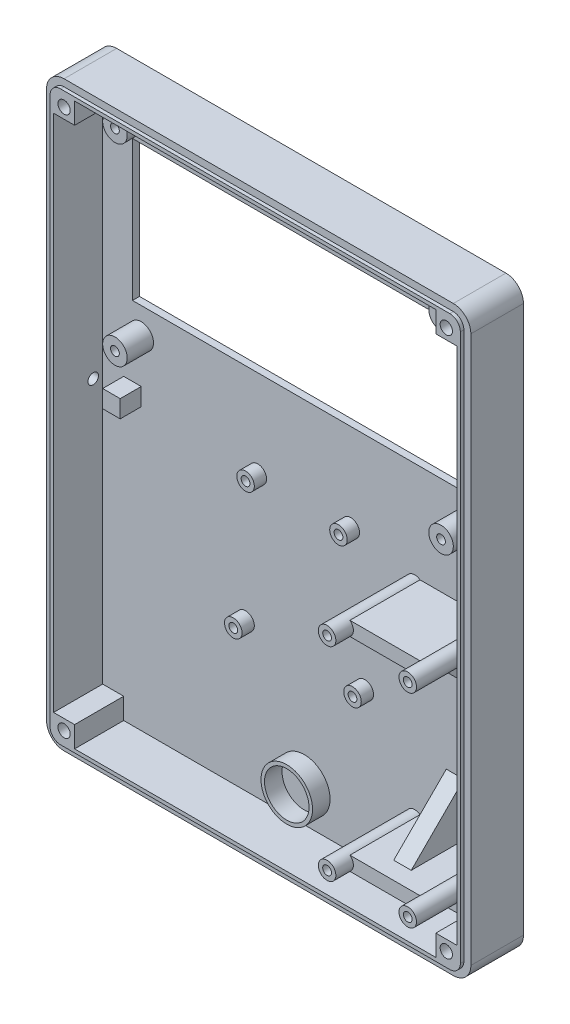
from build123d import *

# Parameters (mm, degrees)
SCHIZZO1_W                    = 115
SCHIZZO1_H                    = 160
SCHIZZO1_W_2                  = 98
SCHIZZO1_H_2                  = 40
ESTRUSIONE_ESTRUSIONE1_DEPTH  = 2
SCHIZZO2_R                    = 3.5
SCHIZZO2_R_2                  = 1.25
ESTRUSIONE_ESTRUSIONE2_DEPTH  = 7.5
SCHIZZO3_R                    = 2.5
SCHIZZO3_R_2                  = 1.25
ESTRUSIONE_ESTRUSIONE3_DEPTH  = 3.5
SCHIZZO4_W                    = 121
SCHIZZO4_H                    = 166
SCHIZZO4_W_2                  = 115
SCHIZZO4_H_2                  = 160
ESTRUSIONE_ESTRUSIONE4_DEPTH  = 15
SCHIZZO5_W                    = 117
SCHIZZO5_H                    = 162
SCHIZZO5_W_2                  = 115
SCHIZZO5_H_2                  = 160
ESTRUSIONE_ESTRUSIONE5_DEPTH  = 1
RACCORDO2_R                   = 5
RACCORDO3_R                   = 3
SCHIZZO6_W                    = 6
SCHIZZO6_H                    = 6
SCHIZZO6_R                    = 1.75
ESTRUSIONE_ESTRUSIONE6_DEPTH  = 14
SCHIZZO7_R                    = 2.5
SCHIZZO7_R_2                  = 1.25
ESTRUSIONE_ESTRUSIONE7_DEPTH  = 25
SCHIZZO8_W                    = 20
SCHIZZO8_H                    = 4
ESTRUSIONE_ESTRUSIONE8_DEPTH  = 20
SCHIZZO9_W                    = 5
SCHIZZO9_H                    = 15
ESTRUSIONE_ESTRUSIONE9_DEPTH  = 15
SMUSSO1_SIZE                  = 15
SCHIZZO10_R                   = 0.75
TAGLIO_ESTRUSIONE1_DEPTH      = 15
SCHIZZO11_R                   = 7.35
SCHIZZO11_R_2                 = 6.35
ESTRUSIONE_ESTRUSIONE10_DEPTH = 5
SCHIZZO12_W                   = 5
SCHIZZO12_H                   = 5
ESTRUSIONE_ESTRUSIONE11_DEPTH = 6
SCHIZZO13_R                   = 1.5
TAGLIO_ESTRUSIONE2_DEPTH      = 142.992957572


with BuildPart() as part:
    # Schizzo1 → Estrusione-Estrusione1 (new body)
    with BuildSketch(Plane.XY):
        Rectangle(SCHIZZO1_W, SCHIZZO1_H)
        with Locations((0, 45)):
            Rectangle(SCHIZZO1_W_2, SCHIZZO1_H_2, mode=Mode.SUBTRACT)
    extrude(amount=ESTRUSIONE_ESTRUSIONE1_DEPTH)

    # Schizzo2 → Estrusione-Estrusione2 (add)
    # profile 1 of 4: a face of its own
    with BuildSketch(Plane.XY.offset(2)):
        with Locations((-46.5, 72.5)):
            Circle(SCHIZZO2_R)
        with Locations((-46.5, 72.5)):
            Circle(SCHIZZO2_R_2, mode=Mode.SUBTRACT)
    # profile 2 of 4: a face of its own
    with BuildSketch(Plane.XY.offset(2)):
        with Locations((-46.5, 17.5)):
            Circle(SCHIZZO2_R)
        with Locations((-46.5, 17.5)):
            Circle(SCHIZZO2_R_2, mode=Mode.SUBTRACT)
    # profile 3 of 4: a face of its own
    with BuildSketch(Plane.XY.offset(2)):
        with Locations((46.5, 17.5)):
            Circle(SCHIZZO2_R)
        with Locations((46.5, 17.5)):
            Circle(SCHIZZO2_R_2, mode=Mode.SUBTRACT)
    # profile 4 of 4: a face of its own
    with BuildSketch(Plane.XY.offset(2)):
        with Locations((46.5, 72.5)):
            Circle(SCHIZZO2_R)
        with Locations((46.5, 72.5)):
            Circle(SCHIZZO2_R_2, mode=Mode.SUBTRACT)
    extrude(amount=ESTRUSIONE_ESTRUSIONE2_DEPTH)

    # Schizzo3 → Estrusione-Estrusione3 (add)
    # profile 1 of 4: a face of its own
    with BuildSketch(Plane.XY.offset(2)):
        with Locations((-13.25, 0)):
            Circle(SCHIZZO3_R)
        with Locations((-13.25, 0)):
            Circle(SCHIZZO3_R_2, mode=Mode.SUBTRACT)
    # profile 2 of 4: a face of its own
    with BuildSketch(Plane.XY.offset(2)):
        with Locations((13.25, 0)):
            Circle(SCHIZZO3_R)
        with Locations((13.25, 0)):
            Circle(SCHIZZO3_R_2, mode=Mode.SUBTRACT)
    # profile 3 of 4: a face of its own
    with BuildSketch(Plane.XY.offset(2)):
        with Locations((17.25, -38)):
            Circle(SCHIZZO3_R)
        with Locations((17.25, -38)):
            Circle(SCHIZZO3_R_2, mode=Mode.SUBTRACT)
    # profile 4 of 4: a face of its own
    with BuildSketch(Plane.XY.offset(2)):
        with Locations((-16.75, -38)):
            Circle(SCHIZZO3_R)
        with Locations((-16.75, -38)):
            Circle(SCHIZZO3_R_2, mode=Mode.SUBTRACT)
    extrude(amount=ESTRUSIONE_ESTRUSIONE3_DEPTH)

    # Schizzo4 → Estrusione-Estrusione4 (add)
    with BuildSketch(Plane(origin=(0, 0, 0), x_dir=(-1, 0, 0), z_dir=(0, 0, -1))):
        Rectangle(SCHIZZO4_W, SCHIZZO4_H)
        Rectangle(SCHIZZO4_W_2, SCHIZZO4_H_2, mode=Mode.SUBTRACT)
    extrude(amount=-ESTRUSIONE_ESTRUSIONE4_DEPTH)

    # Schizzo5 → Estrusione-Estrusione5 (add)
    with BuildSketch(Plane.XY.offset(15)):
        Rectangle(SCHIZZO5_W, SCHIZZO5_H)
        Rectangle(SCHIZZO5_W_2, SCHIZZO5_H_2, mode=Mode.SUBTRACT)
    extrude(amount=ESTRUSIONE_ESTRUSIONE5_DEPTH)

    # Raccordo2
    raccordo2_edges = [part.edges().sort_by_distance(p)[0] for p in [
        (60.5, 83, 7.5),
        (-60.5, 83, 7.5),
        (-60.5, -83, 7.5),
        (60.5, -83, 7.5),
    ]]
    fillet(raccordo2_edges, radius=RACCORDO2_R)

    # Raccordo3
    raccordo3_edges = [part.edges().sort_by_distance(p)[0] for p in [
        (-58.5, 81, 15.5),
        (-58.5, -81, 15.5),
        (58.5, -81, 15.5),
        (58.5, 81, 15.5),
    ]]
    fillet(raccordo3_edges, radius=RACCORDO3_R)

    # Schizzo6 → Estrusione-Estrusione6 (add)
    # profile 1 of 4: a face of its own
    with BuildSketch(Plane.XY.offset(2)):
        with Locations((-54.5, 77)):
            Rectangle(SCHIZZO6_W, SCHIZZO6_H)
        with Locations((-54.5, 77)):
            Circle(SCHIZZO6_R, mode=Mode.SUBTRACT)
    # profile 2 of 4: a face of its own
    with BuildSketch(Plane.XY.offset(2)):
        with Locations((54.5, 77)):
            Rectangle(SCHIZZO6_W, SCHIZZO6_H)
        with Locations((54.5, 77)):
            Circle(SCHIZZO6_R, mode=Mode.SUBTRACT)
    # profile 3 of 4: a face of its own
    with BuildSketch(Plane.XY.offset(2)):
        with Locations((-54.5, -77)):
            Rectangle(SCHIZZO6_W, SCHIZZO6_H)
        with Locations((-54.5, -77)):
            Circle(SCHIZZO6_R, mode=Mode.SUBTRACT)
    # profile 4 of 4: a face of its own
    with BuildSketch(Plane.XY.offset(2)):
        with Locations((54.5, -77)):
            Rectangle(SCHIZZO6_W, SCHIZZO6_H)
        with Locations((54.5, -77)):
            Circle(SCHIZZO6_R, mode=Mode.SUBTRACT)
    extrude(amount=ESTRUSIONE_ESTRUSIONE6_DEPTH)

    # Schizzo7 → Estrusione-Estrusione7 (add)
    # profile 1 of 4: a face of its own
    with BuildSketch(Plane.XY.offset(2)):
        with Locations((54.5, -5)):
            Circle(SCHIZZO7_R)
        with Locations((54.5, -5)):
            Circle(SCHIZZO7_R_2, mode=Mode.SUBTRACT)
    # profile 2 of 4: a face of its own
    with BuildSketch(Plane.XY.offset(2)):
        with Locations((31.5, -5)):
            Circle(SCHIZZO7_R)
        with Locations((31.5, -5)):
            Circle(SCHIZZO7_R_2, mode=Mode.SUBTRACT)
    # profile 3 of 4: a face of its own
    with BuildSketch(Plane.XY.offset(2)):
        with Locations((31.5, -63)):
            Circle(SCHIZZO7_R)
        with Locations((31.5, -63)):
            Circle(SCHIZZO7_R_2, mode=Mode.SUBTRACT)
    # profile 4 of 4: a face of its own
    with BuildSketch(Plane.XY.offset(2)):
        with Locations((54.5, -63)):
            Circle(SCHIZZO7_R)
        with Locations((54.5, -63)):
            Circle(SCHIZZO7_R_2, mode=Mode.SUBTRACT)
    extrude(amount=ESTRUSIONE_ESTRUSIONE7_DEPTH)

    # Schizzo8 → Estrusione-Estrusione8 (add)
    with BuildSketch(Plane.XY.offset(2)):
        with Locations((43, -5)):
            Rectangle(SCHIZZO8_W, SCHIZZO8_H)
        with Locations((43, -63)):
            Rectangle(SCHIZZO8_W, SCHIZZO8_H)
    extrude(amount=ESTRUSIONE_ESTRUSIONE8_DEPTH)

    # Schizzo9 → Estrusione-Estrusione9 (add)
    with BuildSketch(Plane.XY.offset(2)):
        with Locations((43, -14.5)):
            Rectangle(SCHIZZO9_W, SCHIZZO9_H)
        with Locations((43, -53.5)):
            Rectangle(SCHIZZO9_W, SCHIZZO9_H)
    extrude(amount=ESTRUSIONE_ESTRUSIONE9_DEPTH)

    # Smusso1
    smusso1_edges = [part.edges().sort_by_distance(p)[0] for p in [
        (43, -46, 17),
        (43, -22, 17),
    ]]
    chamfer(smusso1_edges, length=SMUSSO1_SIZE - 0.0001)  # a hair under: the kernel refuses the full size

    # Schizzo10 → Taglio-Estrusione1 (cut)
    with BuildSketch(Plane.XY.offset(2)):
        with Locations((0, -70)):
            Circle(SCHIZZO10_R)
    extrude(amount=-TAGLIO_ESTRUSIONE1_DEPTH, mode=Mode.SUBTRACT)

    # Schizzo11 → Estrusione-Estrusione10 (add)
    with BuildSketch(Plane.XY.offset(2)):
        with Locations((0, -70)):
            Circle(SCHIZZO11_R)
        with Locations((0, -70)):
            Circle(SCHIZZO11_R_2, mode=Mode.SUBTRACT)
    extrude(amount=ESTRUSIONE_ESTRUSIONE10_DEPTH)

    # Schizzo12 → Estrusione-Estrusione11 (add)
    with BuildSketch(Plane.XY.offset(2)):
        with Locations((-49, 2.5)):
            Rectangle(SCHIZZO12_W, SCHIZZO12_H)
    extrude(amount=ESTRUSIONE_ESTRUSIONE11_DEPTH)

    # Schizzo13 → Taglio-Estrusione2 (cut, through all)
    with BuildSketch(Plane.ZY.offset(51.5)):
        with Locations(Location((4.696636297, 2.763205457, 0), (0, 0, 270))):
            Circle(SCHIZZO13_R)
    extrude(amount=TAGLIO_ESTRUSIONE2_DEPTH, mode=Mode.SUBTRACT)


solid = part.part
